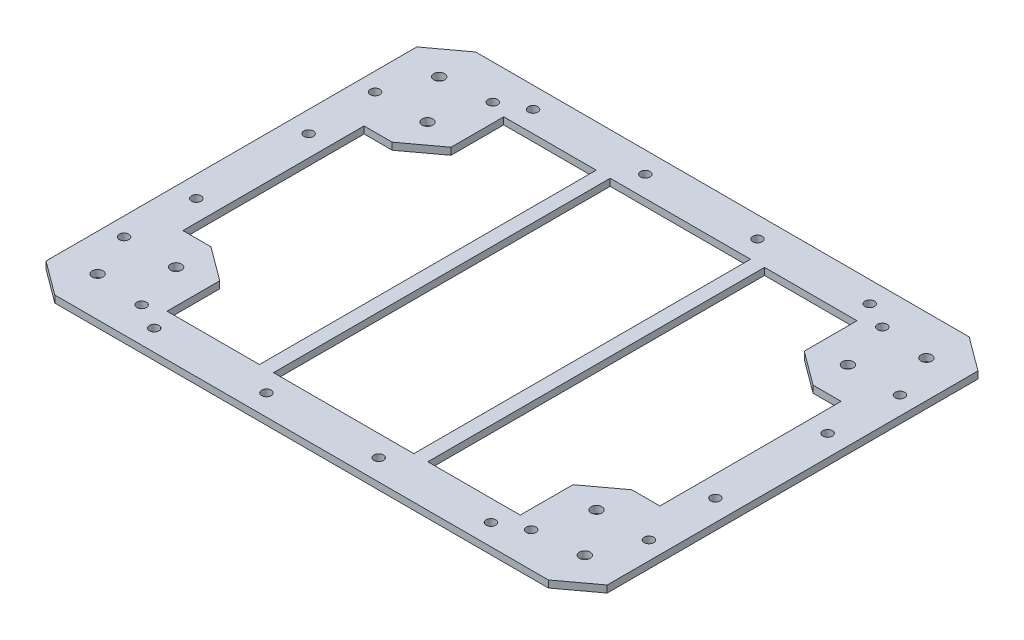
from build123d import *

# Parameters (mm, degrees)
SKETCH1_W           = 63.5
SKETCH1_H           = 152.4
BOSS_EXTRUDE1_DEPTH = 3.175
SKETCH2_R           = 2.4638
SKETCH2_R_2         = 2.159
CUT_EXTRUDE1_DEPTH  = 159.781746826
SKETCH3_R           = 2.159
CUT_EXTRUDE2_DEPTH  = 159.781746826


with BuildPart() as part:
    # Sketch1 → Boss-Extrude1 (new body)
    with BuildSketch(Plane(origin=(0, 0, 0), x_dir=(1, 0, 0), z_dir=(0, 1, 0))):
        Polygon((-111.686526805, 95.25), (-127, 83.918625912), (-127, -83.918625912), (-111.686526805, -95.25), (111.686526805, -95.25), (127, -83.918625912), (127, 83.918625912), (111.686526805, 95.25), align=None)
        Polygon((-107.95, -41.010963508), (-107.95, 41.010963508), (-95.25, 41.010963508), (-79.936526805, 52.342337595), (-79.936526805, 76.2), (-38.1, 76.2), (-38.1, -76.2), (-79.936526805, -76.2), (-79.936526805, -52.342337595), (-95.25, -41.010963508), align=None, mode=Mode.SUBTRACT)
        Rectangle(SKETCH1_W, SKETCH1_H, mode=Mode.SUBTRACT)
        Polygon((79.936526805, -76.2), (38.1, -76.2), (38.1, 76.2), (79.936526805, 76.2), (79.936526805, 52.342337595), (95.25, 41.010963508), (107.95, 41.010963508), (107.95, -41.010963508), (95.25, -41.010963508), (79.936526805, -52.342337595), align=None, mode=Mode.SUBTRACT)
    extrude(amount=BOSS_EXTRUDE1_DEPTH)

    # Sketch2 → Cut-Extrude1 (cut, through all)
    with BuildSketch(Plane(origin=(0, 3.175, 0), x_dir=(1, 0, 0), z_dir=(0, 1, 0))):
        with Locations((-95.147512794, 56.885632681)):
            Circle(SKETCH2_R)
        with Locations((-110.256011578, 77.303596941)):
            Circle(SKETCH2_R)
        with Locations((110.256011578, 77.303596941)):
            Circle(SKETCH2_R)
        with Locations((95.147512794, 56.885632681)):
            Circle(SKETCH2_R)
        with Locations((110.256011578, -77.303596941)):
            Circle(SKETCH2_R)
        with Locations((95.147512794, -56.885632681)):
            Circle(SKETCH2_R)
        with Locations((-110.256011578, -77.303596941)):
            Circle(SKETCH2_R)
        with Locations((-95.147512794, -56.885632681)):
            Circle(SKETCH2_R)
        with Locations((-88.154790208, 79.461855841)):
            Circle(SKETCH2_R_2)
        with Locations((-118.781736597, 56.799107666)):
            Circle(SKETCH2_R_2)
        with Locations((118.781736597, 56.799107666)):
            Circle(SKETCH2_R_2)
        with Locations((88.154790208, 79.461855841)):
            Circle(SKETCH2_R_2)
        with Locations((118.781736597, -56.799107666)):
            Circle(SKETCH2_R_2)
        with Locations((88.154790208, -79.461855841)):
            Circle(SKETCH2_R_2)
        with Locations((-88.154790208, -79.461855841)):
            Circle(SKETCH2_R_2)
        with Locations((-118.781736597, -56.799107666)):
            Circle(SKETCH2_R_2)
    extrude(amount=-CUT_EXTRUDE1_DEPTH, mode=Mode.SUBTRACT)

    # Sketch3 → Cut-Extrude2 (cut, through all)
    with BuildSketch(Plane(origin=(0, 3.175, 0), x_dir=(1, 0, 0), z_dir=(0, 1, 0))):
        with Locations((-76.2, 85.725)):
            Circle(SKETCH3_R)
        with Locations((-25.4, 85.725)):
            Circle(SKETCH3_R)
        with Locations((25.4, 85.725)):
            Circle(SKETCH3_R)
        with Locations((76.2, 85.725)):
            Circle(SKETCH3_R)
        with Locations((76.2, -85.725)):
            Circle(SKETCH3_R)
        with Locations((25.4, -85.725)):
            Circle(SKETCH3_R)
        with Locations((-25.4, -85.725)):
            Circle(SKETCH3_R)
        with Locations((-76.2, -85.725)):
            Circle(SKETCH3_R)
        with Locations((-117.475, -25.4)):
            Circle(SKETCH3_R)
        with Locations((-117.475, 25.4)):
            Circle(SKETCH3_R)
        with Locations((117.475, 25.4)):
            Circle(SKETCH3_R)
        with Locations((117.475, -25.4)):
            Circle(SKETCH3_R)
    extrude(amount=-CUT_EXTRUDE2_DEPTH, mode=Mode.SUBTRACT)


solid = part.part
